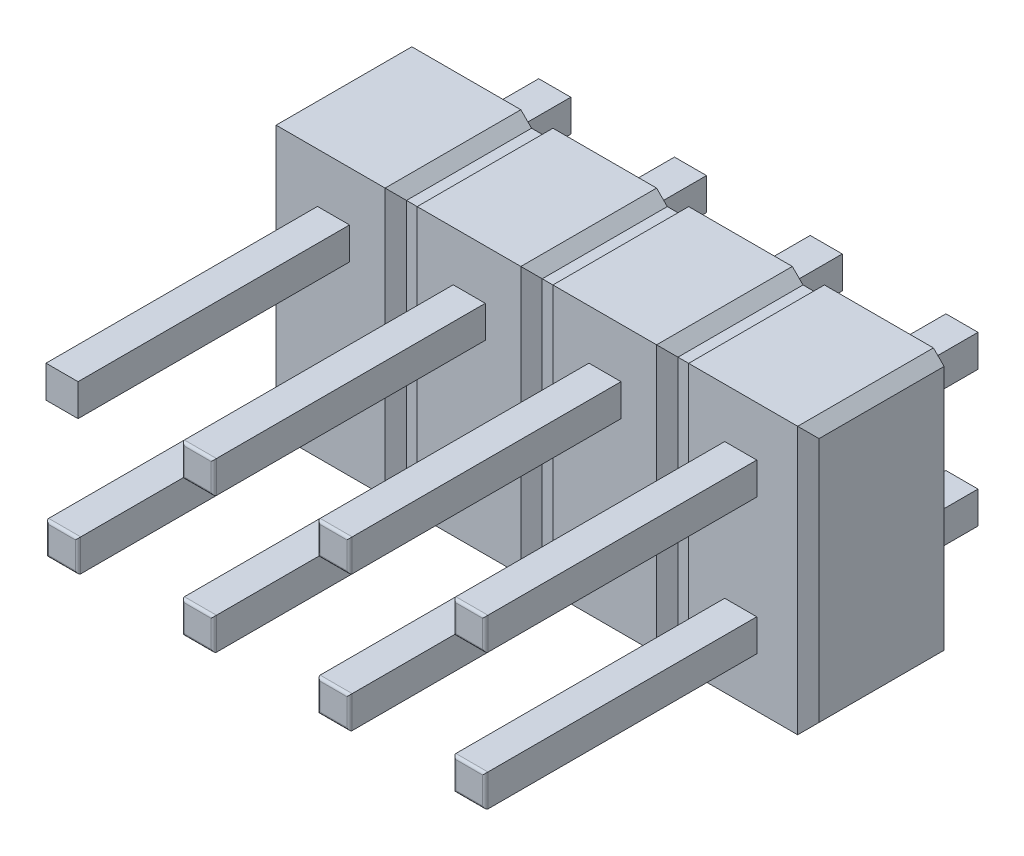
from build123d import *

# Parameters (mm, degrees)
EXTRUDE_1_DEPTH             = 2.54
SKETCH_2_W                  = 0.599854391
SKETCH_2_H                  = 0.599854392
EXTRUDE_2_DEPTH             = 5.08
SKETCH_4_W                  = 0.2
SKETCH_4_H                  = 5
CUT_EXTRUDE_2_DEPTH         = 0.2
CUT_EXTRUDE_3_REACH         = 9.607
SKETCH_5_W                  = 0.2
SKETCH_5_H                  = 0.2
PATTERN_LINEAR_2_COUNT      = 3
PATTERN_LINEAR_2_PITCH      = 2.54
CHAMFER_1_SIZE              = 0.2
CHAMFER_2_SIZE              = 0.2
PATTERN_LINEAR_3_COUNT      = 4
PATTERN_LINEAR_3_PITCH      = 2.54
PATTERN_LINEAR_3_COUNT_DIR2 = 2
PATTERN_LINEAR_3_PITCH_DIR2 = 2.54
FILLET_4_R                  = 0.05
SKETCH_6_W                  = 13.31877373
SKETCH_6_H                  = 4.876948745
CUT_EXTRUDE_4_DEPTH         = 10


with BuildPart() as part:
    # 草图1 → 凸台-拉伸1 (new body)
    with BuildSketch(Plane.XY):
        Polygon((5.08, 2.5), (-5.08, 2.5), (-5.08, 0), (-5.08, -2.5), (5.08, -2.5), (5.08, 0), align=None)
    extrude(amount=EXTRUDE_1_DEPTH)

    # 草图2 → 凸台-拉伸2 (add, symmetric)
    with BuildSketch(Plane.XY.offset(2.54)):
        with Locations((-3.805698419, 1.27)):
            Rectangle(SKETCH_2_W, SKETCH_2_H)
    extrude_2 = extrude(amount=EXTRUDE_2_DEPTH, both=True)

    # 草图4 → 切除-拉伸2 (cut)
    with BuildSketch(Plane.XY.offset(2.54)):
        with Locations((-2.54, 0)):
            Rectangle(SKETCH_4_W, SKETCH_4_H)
    cut_extrude_2 = extrude(amount=-CUT_EXTRUDE_2_DEPTH, mode=Mode.SUBTRACT)

    # 草图5 → 切除-拉伸3 (cut, up to next)
    with BuildSketch(Plane.XY.offset(2.54), mode=Mode.PRIVATE) as cut_extrude_3_sk1:
        with Locations((-2.54, 2.4)):
            Rectangle(SKETCH_5_W, SKETCH_5_H)
    cut_extrude_3_tool1 = extrude(cut_extrude_3_sk1.sketch, amount=-CUT_EXTRUDE_3_REACH, mode=Mode.PRIVATE) & part.part
    # 草图5 → 切除-拉伸3 (cut, up to next)
    with BuildSketch(Plane.XY.offset(2.54), mode=Mode.PRIVATE) as cut_extrude_3_sk2:
        with Locations((-2.54, -2.4)):
            Rectangle(SKETCH_5_W, SKETCH_5_H)
    cut_extrude_3_tool2 = extrude(cut_extrude_3_sk2.sketch, amount=-CUT_EXTRUDE_3_REACH, mode=Mode.PRIVATE) & part.part
    cut_extrude_3_1 = cut_extrude_3_tool1.solids().sort_by_distance((-2.54, 2.4, 2.54))[0]
    add(cut_extrude_3_1, mode=Mode.SUBTRACT)
    cut_extrude_3_2 = cut_extrude_3_tool2.solids().sort_by_distance((-2.54, -2.4, 2.54))[0]
    add(cut_extrude_3_2, mode=Mode.SUBTRACT)
    cut_extrude_3 = cut_extrude_3_1 + cut_extrude_3_2  # 切除-拉伸3 as one shape, for the pattern or mirror that repeats it

    # 阵列(线性)2: 切除-拉伸2, 切除-拉伸3 ×3
    with Locations(*[(i * PATTERN_LINEAR_2_PITCH, 0, 0) for i in range(1, PATTERN_LINEAR_2_COUNT)]):
        add(cut_extrude_2, mode=Mode.SUBTRACT)
        add(cut_extrude_3, mode=Mode.SUBTRACT)

    # 倒角1
    chamfer_1_edges = [part.edges().sort_by_distance(p)[0] for p in [
        (5.08, -1.25, 2.54),
        (-5.08, 2.5, 1.27),
        (5.08, 2.5, 1.27),
        (5.08, -2.5, 1.27),
        (-5.08, -2.5, 1.27),
        (-5.08, -1.25, 2.54),
    ]]
    chamfer(chamfer_1_edges, length=CHAMFER_1_SIZE)

    # 倒角2
    chamfer_2_edges = [part.edges().sort_by_distance(p)[0] for p in [
        (-2.64, -2.5, 1.27),
        (2.44, -2.5, 1.27),
        (0.1, -2.5, 1.27),
        (2.64, -2.5, 1.27),
        (-0.1, -2.5, 1.27),
        (-2.44, -2.5, 1.27),
        (2.64, 0, 2.54),
        (-2.64, 0, 2.54),
        (-0.1, 0, 2.54),
        (-2.44, 0, 2.54),
        (2.44, 0, 2.54),
        (0.1, 0, 2.54),
        (2.64, 2.5, 1.27),
        (-0.1, 2.5, 1.27),
        (-2.44, 2.5, 1.27),
        (2.44, 2.5, 1.27),
        (0.1, 2.5, 1.27),
        (-2.64, 2.5, 1.27),
    ]]
    chamfer(chamfer_2_edges, length=CHAMFER_2_SIZE - 0.0001)  # a hair under: the kernel refuses the full size

    # 阵列(线性)3: Extrude 2 4 × 2
    with Locations(*[(i * PATTERN_LINEAR_3_PITCH, -j * PATTERN_LINEAR_3_PITCH_DIR2, 0) for i in range(PATTERN_LINEAR_3_COUNT) for j in range(PATTERN_LINEAR_3_COUNT_DIR2) if (i, j) != (0, 0)]):
        add(extrude_2)

    # 圆角4
    fillet_4_edges = [part.edges().sort_by_distance(p)[0] for p in [
        (-3.805698419, -0.970072804, -2.54),
        (-4.105625614, -1.27, -2.54),
        (-3.805698419, -1.569927196, -2.54),
        (-3.505771223, -1.27, -2.54),
        (-3.805698419, -0.970072804, 7.62),
        (-4.105625614, -1.27, 7.62),
        (-3.805698419, -1.569927196, 7.62),
        (-3.505771223, -1.27, 7.62),
        (-1.265698419, 1.569927196, -2.54),
        (-1.565625614, 1.27, -2.54),
        (-1.265698419, 0.970072804, -2.54),
        (-0.965771223, 1.27, -2.54),
        (-1.265698419, 1.569927196, 7.62),
        (-1.565625614, 1.27, 7.62),
        (-1.265698419, 0.970072804, 7.62),
        (-0.965771223, 1.27, 7.62),
        (-1.265698419, -0.970072804, -2.54),
        (-1.565625614, -1.27, -2.54),
        (-1.265698419, -1.569927196, -2.54),
        (-0.965771223, -1.27, -2.54),
        (-1.265698419, -0.970072804, 7.62),
        (-1.565625614, -1.27, 7.62),
        (-1.265698419, -1.569927196, 7.62),
        (-0.965771223, -1.27, 7.62),
        (1.274301581, 1.569927196, -2.54),
        (0.974374386, 1.27, -2.54),
        (1.274301581, 0.970072804, -2.54),
        (1.574228777, 1.27, -2.54),
        (1.274301581, 1.569927196, 7.62),
        (0.974374386, 1.27, 7.62),
        (1.274301581, 0.970072804, 7.62),
        (1.574228777, 1.27, 7.62),
        (1.274301581, -0.970072804, -2.54),
        (0.974374386, -1.27, -2.54),
        (1.274301581, -1.569927196, -2.54),
        (1.574228777, -1.27, -2.54),
        (1.274301581, -0.970072804, 7.62),
        (0.974374386, -1.27, 7.62),
        (1.274301581, -1.569927196, 7.62),
        (1.574228777, -1.27, 7.62),
        (3.814301581, 1.569927196, -2.54),
        (3.514374386, 1.27, -2.54),
        (3.814301581, 0.970072804, -2.54),
        (4.114228777, 1.27, -2.54),
        (3.814301581, 1.569927196, 7.62),
        (3.514374386, 1.27, 7.62),
        (3.814301581, 0.970072804, 7.62),
        (4.114228777, 1.27, 7.62),
        (3.814301581, -0.970072804, -2.54),
        (3.514374386, -1.27, -2.54),
        (3.814301581, -1.569927196, -2.54),
        (4.114228777, -1.27, -2.54),
        (3.814301581, -0.970072804, 7.62),
        (3.514374386, -1.27, 7.62),
        (3.814301581, -1.569927196, 7.62),
        (4.114228777, -1.27, 7.62),
    ]]
    fillet(fillet_4_edges, radius=FILLET_4_R)

    # 草图6 → 切除-拉伸4 (cut)
    with BuildSketch(Plane.XZ.offset(2.5)):
        with Locations((0.654637262, -4.038474373)):
            Rectangle(SKETCH_6_W, SKETCH_6_H)
    extrude(amount=-CUT_EXTRUDE_4_DEPTH, mode=Mode.SUBTRACT)


solid = part.part
